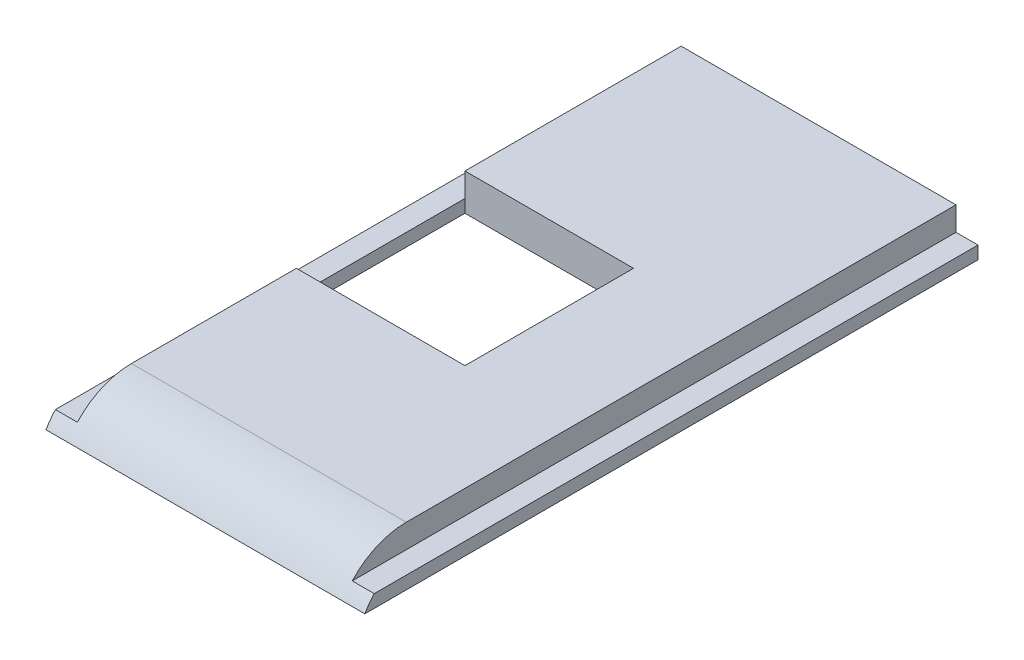
from build123d import *

# Parameters (mm, degrees)
SKICA1_W                 = 17.4
SKICA1_H                 = 27
P_IDAT_VYSUNUT_M1_DEPTH  = 2
SKICA2_W                 = 17.4
SKICA2_H                 = 27
P_IDAT_VYSUNUT_M2_DEPTH  = 6
ZAOBLIT1_R               = 4
SKICA3_W                 = 17.4
SKICA3_H                 = 27
ODEBRAT_VYSUNUT_M1_DEPTH = 6
SKICA4_W                 = 1.2
SKICA4_H                 = 26.464101615
ODEBRAT_VYSUNUT_M2_DEPTH = 1.2
SKICA7_W                 = 15
SKICA7_H                 = 1.2
SKICA7_W_2               = 17.4
SKICA7_H_2               = 0.8
P_IDAT_VYSUNUT_M3_DEPTH  = 7
SKICA8_W                 = 9.2
SKICA8_H                 = 9.2
ODEBRAT_VYSUNUT_M5_DEPTH = 7
SKICA9_W                 = 1.2
SKICA9_H                 = 33.464101615
ODEBRAT_VYSUNUT_M6_DEPTH = 1.3


with BuildPart() as part:
    # Skica1 → Přidat vysunutím1 (new body)
    with BuildSketch(Plane(origin=(0, 0, 0), x_dir=(1, 0, 0), z_dir=(0, 1, 0))):
        with Locations((8.7, 13.5)):
            Rectangle(SKICA1_W, SKICA1_H)
    extrude(amount=P_IDAT_VYSUNUT_M1_DEPTH)

    # Skica2 → Přidat vysunutím2 (add)
    with BuildSketch(Plane.XZ):
        with Locations((8.7, -13.5)):
            Rectangle(SKICA2_W, SKICA2_H)
    extrude(amount=P_IDAT_VYSUNUT_M2_DEPTH)

    # Zaoblit1
    zaoblit1_edges = [part.edges().sort_by_distance(p)[0] for p in [
        (8.7, 2, 0),
    ]]
    fillet(zaoblit1_edges, radius=ZAOBLIT1_R)

    # Skica3 → Odebrat vysunutím1 (cut)
    with BuildSketch(Plane.XZ.offset(6)):
        with Locations((8.7, -13.5)):
            Rectangle(SKICA3_W, SKICA3_H)
    extrude(amount=-ODEBRAT_VYSUNUT_M1_DEPTH, mode=Mode.SUBTRACT)

    # Skica4 → Odebrat vysunutím2 (cut)
    with BuildSketch(Plane(origin=(0, 2, 0), x_dir=(1, 0, 0), z_dir=(0, 1, 0))):
        with Locations((0.6, 13.767949192)):
            Rectangle(SKICA4_W, SKICA4_H)
        with Locations((16.8, 13.767949192)):
            Rectangle(SKICA4_W, SKICA4_H)
    extrude(amount=-ODEBRAT_VYSUNUT_M2_DEPTH, mode=Mode.SUBTRACT)

    # Skica7 → Přidat vysunutím3 (add)
    with BuildSketch(Plane(origin=(0, 0, -27), x_dir=(-1, 0, 0), z_dir=(0, 0, -1))):
        with Locations((-8.7, 1.4)):
            Rectangle(SKICA7_W, SKICA7_H)
        with Locations((-8.7, 0.4)):
            Rectangle(SKICA7_W_2, SKICA7_H_2)
    extrude(amount=P_IDAT_VYSUNUT_M3_DEPTH)

    # Skica8 → Odebrat vysunutím5 (cut)
    with BuildSketch(Plane(origin=(0, 2, 0), x_dir=(1, 0, 0), z_dir=(0, 1, 0))):
        with Locations((5.8, 17.6)):
            Rectangle(SKICA8_W, SKICA8_H)
    extrude(amount=-ODEBRAT_VYSUNUT_M5_DEPTH, mode=Mode.SUBTRACT)

    # Skica9 → Odebrat vysunutím6 (cut)
    with BuildSketch(Plane(origin=(0, 2, 0), x_dir=(1, 0, 0), z_dir=(0, 1, 0))):
        with Locations((0.6, 17.267949193)):
            Rectangle(SKICA9_W, SKICA9_H)
        with Locations((16.8, 17.267949193)):
            Rectangle(SKICA9_W, SKICA9_H)
    extrude(amount=-ODEBRAT_VYSUNUT_M6_DEPTH, mode=Mode.SUBTRACT)


solid = part.part
